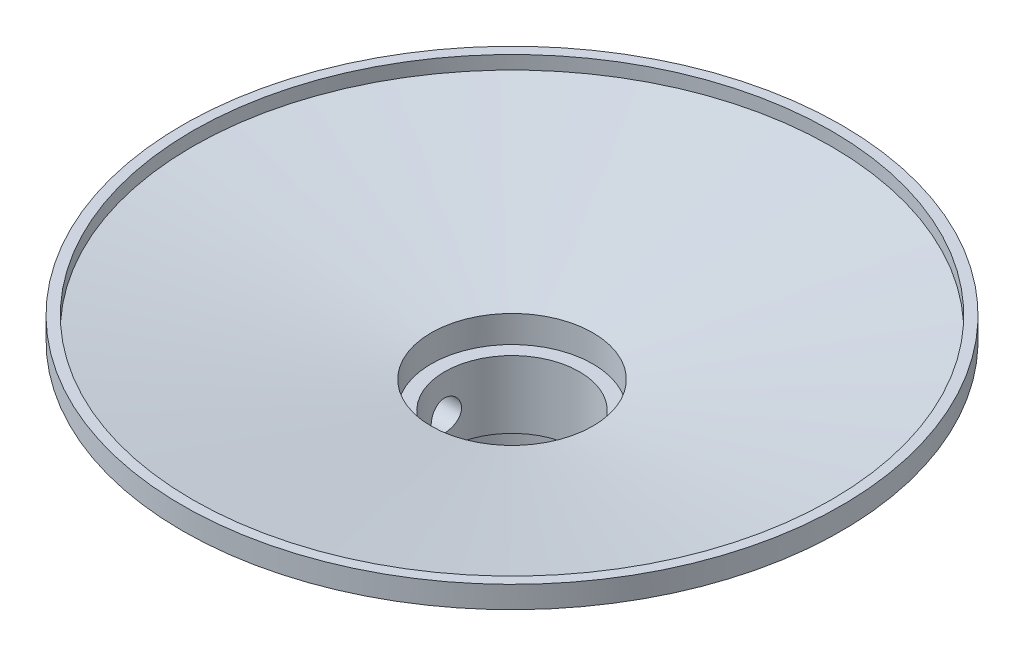
from build123d import *

# Parameters (mm, degrees)
CUT_EXTRUDE6_DEPTH = 74.966622595


with BuildPart() as part:
    # Sketch5 → Revolve5 (revolve)
    with BuildSketch(Plane(origin=(0, 0, 0), x_dir=(0, 0, -1), z_dir=(1, 0, 0))):
        Polygon((48.9, -3.258649447), (48.9, 0), (47.4, 0), (47.4, -2), (12, -8.241975117), (12, -12.241975117), (10, -12.241975117), (10, -22.241975117), (12, -22.241975117), (12, -26.241975117), (13.5, -26.241975117), (13.5, -22.241975117), (13.5, -9.500624564), align=None)
    revolve(axis=Axis((0, 0, 0), (0, 1, 0)))

    # Sketch6 → Cut-Extrude6 (cut, through all)
    with BuildSketch(Plane(origin=(0, 0, 0), x_dir=(0, 0, -1), z_dir=(1, 0, 0))):
        with BuildLine():
            ThreePointArc((-2.25, -17.87129984), (0, -20.12129984), (2.25, -17.87129984))
            ThreePointArc((2.25, -17.87129984), (0, -15.62129984), (-2.25, -17.87129984))
        make_face()
    extrude(amount=-CUT_EXTRUDE6_DEPTH, mode=Mode.SUBTRACT)


solid = part.part
